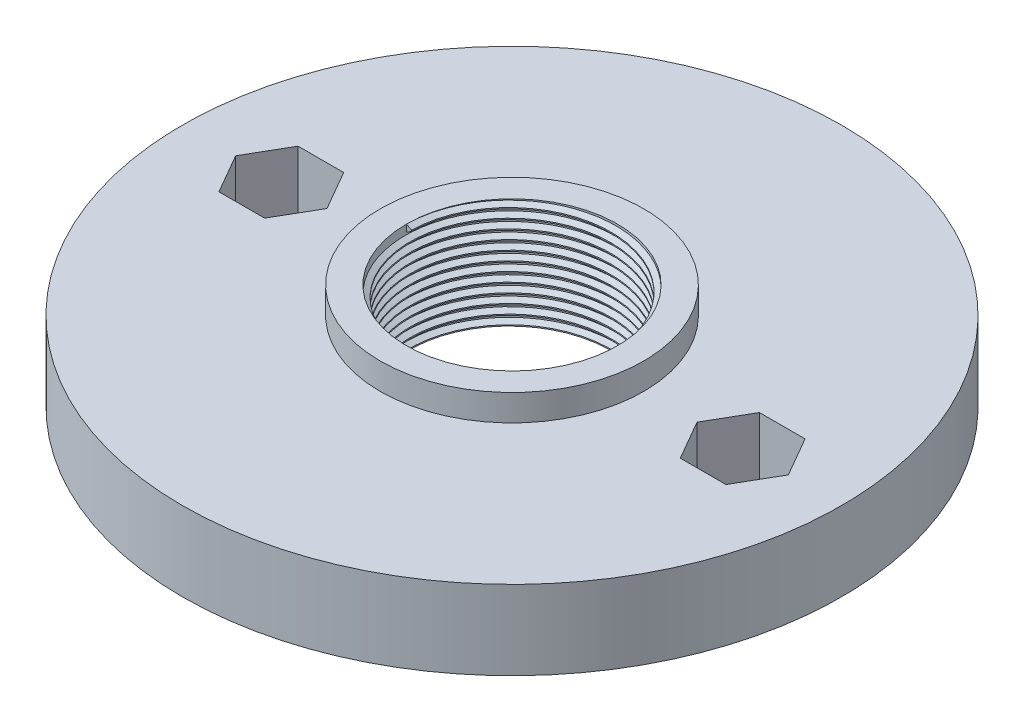
from build123d import *

# Parameters (mm, degrees)
SKETCH1_R           = 12.5
BOSS_EXTRUDE2_DEPTH = 3
SKETCH3_R           = 5
BOSS_EXTRUDE3_DEPTH = 1
SKETCH4_R           = 4
CUT_EXTRUDE1_DEPTH  = 19.12456896
THREAD1_PITCH       = 0.35
CUT_EXTRUDE2_DEPTH  = 18.976235482


with BuildPart() as part:
    # Sketch1 → Boss-Extrude2 (new body)
    with BuildSketch(Plane(origin=(0, 0, 0), x_dir=(1, 0, 0), z_dir=(0, 1, 0))):
        with Locations(Location((0, 0, 0), (0, 0, 270))):
            Circle(SKETCH1_R)
    extrude(amount=BOSS_EXTRUDE2_DEPTH)

    # Sketch3 → Boss-Extrude3 (add)
    with BuildSketch(Plane(origin=(0, 3, 0), x_dir=(1, 0, 0), z_dir=(0, 1, 0))):
        with Locations(Location((0, 0, 0), (0, 0, 270))):
            Circle(SKETCH3_R)
    extrude(amount=BOSS_EXTRUDE3_DEPTH)

    # Sketch4 → Cut-Extrude1 (cut, through all)
    with BuildSketch(Plane(origin=(0, 4, 0), x_dir=(1, 0, 0), z_dir=(0, 1, 0))):
        with Locations(Location((0, 0, 0), (0, 0, 270))):
            Circle(SKETCH4_R)
    extrude(amount=-CUT_EXTRUDE1_DEPTH, mode=Mode.SUBTRACT)

    # Thread1: the profile of Thread Profile1 profile screwed along a right-hand helix of 11.428571 turns, 6 arcs to a turn; built about Z, then put on its axis
    thread1_z = Axis((0, 0, 0), (0, 0, 1))
    thread1_corners = [(4.0003, 0, -0.000173205), (3.810556944, 0, 0.109375), (3.810556944, 0, 0.153125), (4.0003, 0, 0.262673204)]
    with BuildLine(mode=Mode.PRIVATE) as thread1_profile:
        Line(thread1_corners[0], thread1_corners[1])
        Line(thread1_corners[1], thread1_corners[2])
        Line(thread1_corners[2], thread1_corners[3])
        Line(thread1_corners[3], thread1_corners[0])
    thread1_cap = Face(thread1_profile.wire())
    thread1_turn_angles = [0, 30, 60, 90, 120, 150, 180, 210, 240, 270, 300, 330, 360]
    thread1_turn_weights = [1, 0.8660254037844387, 1, 0.8660254037844387, 1, 0.8660254037844387, 1, 0.8660254037844387, 1, 0.8660254037844387, 1, 0.8660254037844387, 1]
    thread1_turn_rails = [Edge.make_bspline([Vector(p[0], p[1], 0).rotate(thread1_z, thread1_turn_angles[k]) / thread1_turn_weights[k] + Vector(0, 0, p[2] + THREAD1_PITCH * thread1_turn_angles[k] / 360) for k in range(13)], [0, 0, 0, 1, 1, 2, 2, 3, 3, 4, 4, 5, 5, 6, 6, 6], 2, thread1_turn_weights) for p in thread1_corners]
    thread1_turn_sides = [Face.make_surface_from_curves(thread1_turn_rails[p[0]], thread1_turn_rails[p[1]]) for p in [(0, 1), (1, 2), (2, 3), (3, 0)]]
    thread1_last_angles = [3960, 3990, 4020, 4050, 4080, 4097.142857143, 4114.285714286]
    thread1_last_weights = [1, 0.8660254037844387, 1, 0.8660254037844387, 1, 0.9555728057861397, 1]
    thread1_last_rails = [Edge.make_bspline([Vector(p[0], p[1], 0).rotate(thread1_z, thread1_last_angles[k]) / thread1_last_weights[k] + Vector(0, 0, p[2] + THREAD1_PITCH * thread1_last_angles[k] / 360) for k in range(7)], [0, 0, 0, 1, 1, 2, 2, 3, 3, 3], 2, thread1_last_weights) for p in thread1_corners]
    thread1_last_sides = [Face.make_surface_from_curves(thread1_last_rails[p[0]], thread1_last_rails[p[1]]) for p in [(0, 1), (1, 2), (2, 3), (3, 0)]]
    thread1 = Plane(origin=(0, 4, 0), x_dir=(-1, 0, 0), z_dir=(0, -1, 0)) * Solid(Shell([*[p.moved(Location((0, 0, THREAD1_PITCH * i))) for i in range(11) for p in thread1_turn_sides], *thread1_last_sides, thread1_cap, thread1_cap.rotate(thread1_z, 4114.285714286).moved(Location((0, 0, THREAD1_PITCH * 4114.285714286 / 360)))]))
    add(thread1)

    # Sketch12 → Cut-Extrude2 (cut, through all)
    with BuildSketch(Plane(origin=(0, 3, 0), x_dir=(1, 0, 0), z_dir=(0, 1, 0))):
        Polygon((10.482050808, 0), (9.616025404, 1.5), (7.883974596, 1.5), (7.017949192, 0), (7.883974596, -1.5), (9.616025404, -1.5), align=None)
    cut_extrude2 = extrude(amount=-CUT_EXTRUDE2_DEPTH, mode=Mode.SUBTRACT)

    # Mirror1: Cut-Extrude2 across plane
    add(cut_extrude2.mirror(Plane(origin=(0, 0, 0), x_dir=(0, 0, 1), z_dir=(1, 0, 0))), mode=Mode.SUBTRACT)


solid = part.part
